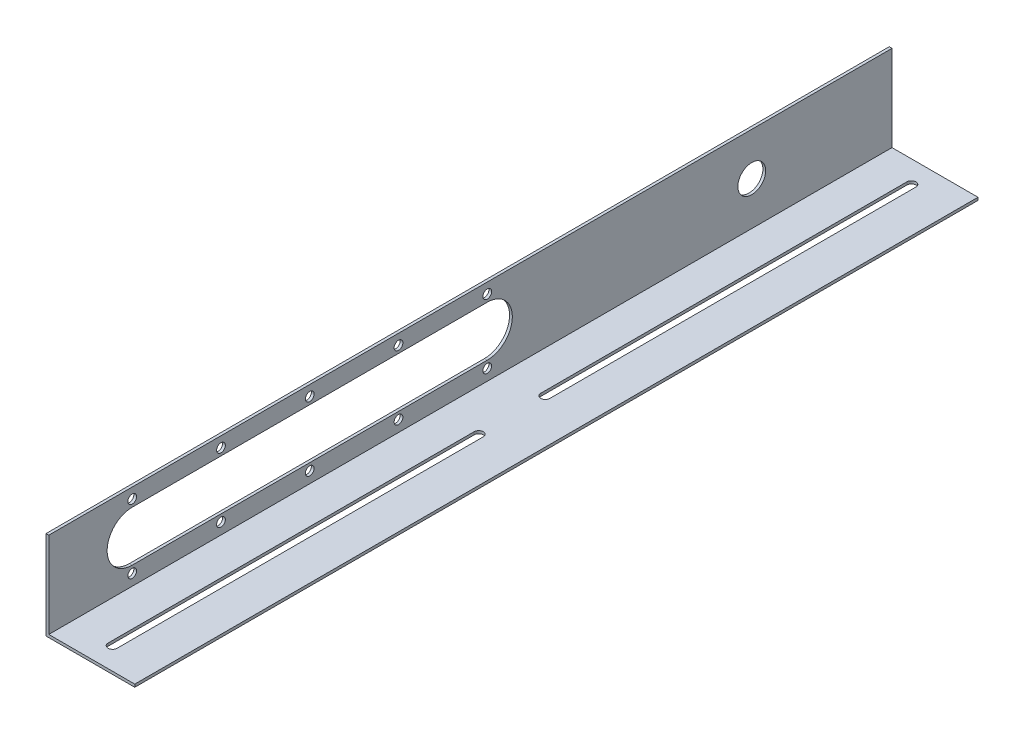
from build123d import *

# Parameters (mm, degrees)
BOSS_EXTRUDE2_DEPTH          = 482.6
CUT_EXTRUDE3_DEPTH           = 488.592555637
SKETCH7_R                    = 7.9629
CUT_EXTRUDE4_DEPTH           = 488.592555637
F_10_0_1935_DIAMETER_HOLE1_D = 4.999999906
CUT_EXTRUDE5_DEPTH           = 488.755338419


with BuildPart() as part:
    # Sketch3 → Boss-Extrude2 (new body)
    with BuildSketch(Plane.XY):
        Polygon((0, 0), (0, 49.2125), (-1.5875, 49.2125), (-1.5875, -1.5875), (49.2125, -1.5875), (49.2125, 0), align=None)
    extrude(amount=BOSS_EXTRUDE2_DEPTH)

    # Sketch6 → Cut-Extrude3 (cut, through all)
    with BuildSketch(Plane(origin=(0, 0, 0), x_dir=(0, 0, -1), z_dir=(1, 0, 0))):
        with BuildLine():
            Line((-434.848, 39.1795), (-231.648, 39.1795))
            ThreePointArc((-231.648, 39.1795), (-217.297, 24.8285), (-231.648, 10.4775))
            Line((-231.648, 10.4775), (-434.848, 10.4775))
            ThreePointArc((-434.848, 10.4775), (-449.199, 24.8285), (-434.848, 39.1795))
        make_face()
    extrude(amount=-CUT_EXTRUDE3_DEPTH, mode=Mode.SUBTRACT)

    # Sketch7 → Cut-Extrude4 (cut, through all)
    with BuildSketch(Plane(origin=(0, 0, 0), x_dir=(0, 0, -1), z_dir=(1, 0, 0))):
        with Locations((-80.264, 24.773594829)):
            Circle(SKETCH7_R)
    extrude(amount=-CUT_EXTRUDE4_DEPTH, mode=Mode.SUBTRACT)

    # #10 (0.1935) Diameter Hole1 (through all)
    with Locations(Plane(origin=(0, 0, 0), x_dir=(0, 0, -1), z_dir=(1, 0, 0))):
        with Locations((-434.848, 43.2435), (-384.048, 43.2435), (-333.248, 43.2435), (-282.448, 43.2435), (-231.648, 43.2435), (-231.648, 6.4135), (-282.448, 6.4135), (-333.248, 6.4135), (-384.048, 6.4135), (-434.848, 6.4135)):
            Hole(F_10_0_1935_DIAMETER_HOLE1_D / 2)

    # Sketch13 → Cut-Extrude5 (cut, through all)
    with BuildSketch(Plane.XZ.offset(1.5875)):
        with BuildLine():
            Line((26.3921875, 469.9), (26.3921875, 260.35))
            ThreePointArc((26.3921875, 260.35), (23.8125, 257.7703125), (21.2328125, 260.35))
            Line((21.2328125, 260.35), (21.2328125, 469.9))
            ThreePointArc((21.2328125, 469.9), (23.8125, 472.4796875), (26.3921875, 469.9))
        make_face()
        with BuildLine():
            Line((21.2328125, 12.7), (21.2328125, 222.25))
            ThreePointArc((21.2328125, 222.25), (23.8125, 224.8296875), (26.3921875, 222.25))
            Line((26.3921875, 222.25), (26.3921875, 12.7))
            ThreePointArc((26.3921875, 12.7), (23.8125, 10.1203125), (21.2328125, 12.7))
        make_face()
    extrude(amount=-CUT_EXTRUDE5_DEPTH, mode=Mode.SUBTRACT)


solid = part.part
